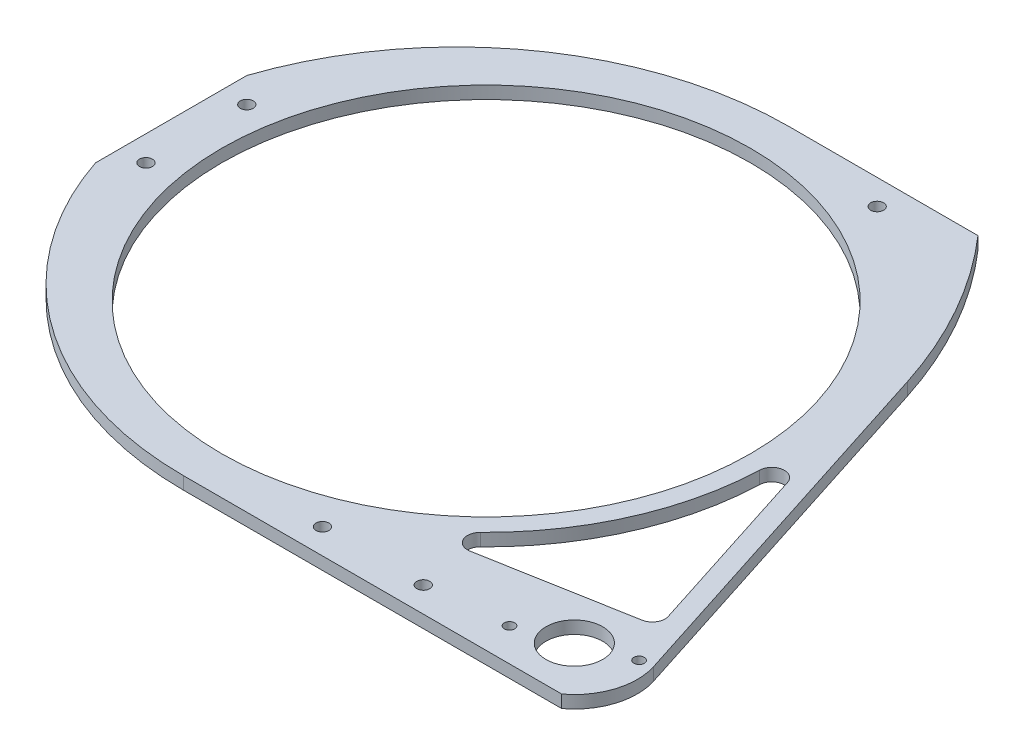
from build123d import *

# Parameters (mm, degrees)
SKETCH1_R           = 3.2639
SKETCH1_R_2         = 133.223
SKETCH1_R_3         = 2.6289
SKETCH1_R_4         = 14.2875
BOSS_EXTRUDE1_DEPTH = 6.35
CUT_EXTRUDE1_DEPTH  = 6.35
FILLET1_R           = 6.35


with BuildPart() as part:
    # Sketch1 → Boss-Extrude1 (new body)
    with BuildSketch(Plane(origin=(0, 0, 0), x_dir=(1, 0, 0), z_dir=(0, 1, 0))):
        with BuildLine():
            Line((95.377, 152.4), (0, 152.4))
            ThreePointArc((0, 152.4), (-97.757028045, 120.848293921), (-158.623, 38.1))
            Line((-158.623, 38.1), (-158.623, 12.7))
            Line((-158.623, 12.7), (-158.623, -12.7))
            Line((-158.623, -12.7), (-158.623, -38.1))
            ThreePointArc((-158.623, -38.1), (-97.757028045, -120.848293921), (0, -152.4))
            Line((0, -152.4), (95.377, -152.4))
            Line((95.377, -152.4), (171.445296232, -152.4))
            Line((171.445296232, -152.4), (190.495296232, -152.4))
            ThreePointArc((190.495296232, -152.4), (201.696875474, -136.638695625), (201.678032583, -117.302363551))
            Line((201.678032583, -117.302363551), (141.305382972, 70.911579924))
            ThreePointArc((141.305382972, 70.911579924), (122.48771702, 113.992848559), (95.377, 152.4))
        make_face()
        with Locations((-145.923, -25.4)):
            Circle(SKETCH1_R, mode=Mode.SUBTRACT)
        Circle(SKETCH1_R_2, mode=Mode.SUBTRACT)
        with Locations((57.277, -139.7)):
            Circle(SKETCH1_R, mode=Mode.SUBTRACT)
        with Locations((108.077, -139.7)):
            Circle(SKETCH1_R, mode=Mode.SUBTRACT)
        with Locations((147.61844328, -135.800061274)):
            Circle(SKETCH1_R_3, mode=Mode.SUBTRACT)
        with Locations((171.445296232, -127)):
            Circle(SKETCH1_R_4, mode=Mode.SUBTRACT)
        with Locations((195.272149183, -118.199938726)):
            Circle(SKETCH1_R_3, mode=Mode.SUBTRACT)
        with Locations((-145.923, 25.4)):
            Circle(SKETCH1_R, mode=Mode.SUBTRACT)
        with Locations((57.277, 139.7)):
            Circle(SKETCH1_R, mode=Mode.SUBTRACT)
    extrude(amount=BOSS_EXTRUDE1_DEPTH)

    # Sketch2 → Cut-Extrude1 (cut)
    with BuildSketch(Plane(origin=(0, 6.35, 0), x_dir=(1, 0, 0), z_dir=(0, 1, 0))):
        with BuildLine():
            Line((81.096337026, -117.475), (185.683760838, -98.624425711))
            Line((185.683760838, -98.624425711), (142.748, 35.229379208))
            Line((142.748, 35.229379208), (142.748, 0))
            ThreePointArc((142.748, 0), (126.398835876, -66.33495152), (81.096337026, -117.475))
        make_face()
    extrude(amount=-CUT_EXTRUDE1_DEPTH, mode=Mode.SUBTRACT)

    # Fillet1
    fillet1_edges = [part.edges().sort_by_distance(p)[0] for p in [
        (81.096337026, 3.175, 117.475),
        (142.748, 3.175, -35.229379208),
        (185.683760838, 3.175, 98.624425711),
    ]]
    fillet(fillet1_edges, radius=FILLET1_R)


solid = part.part
